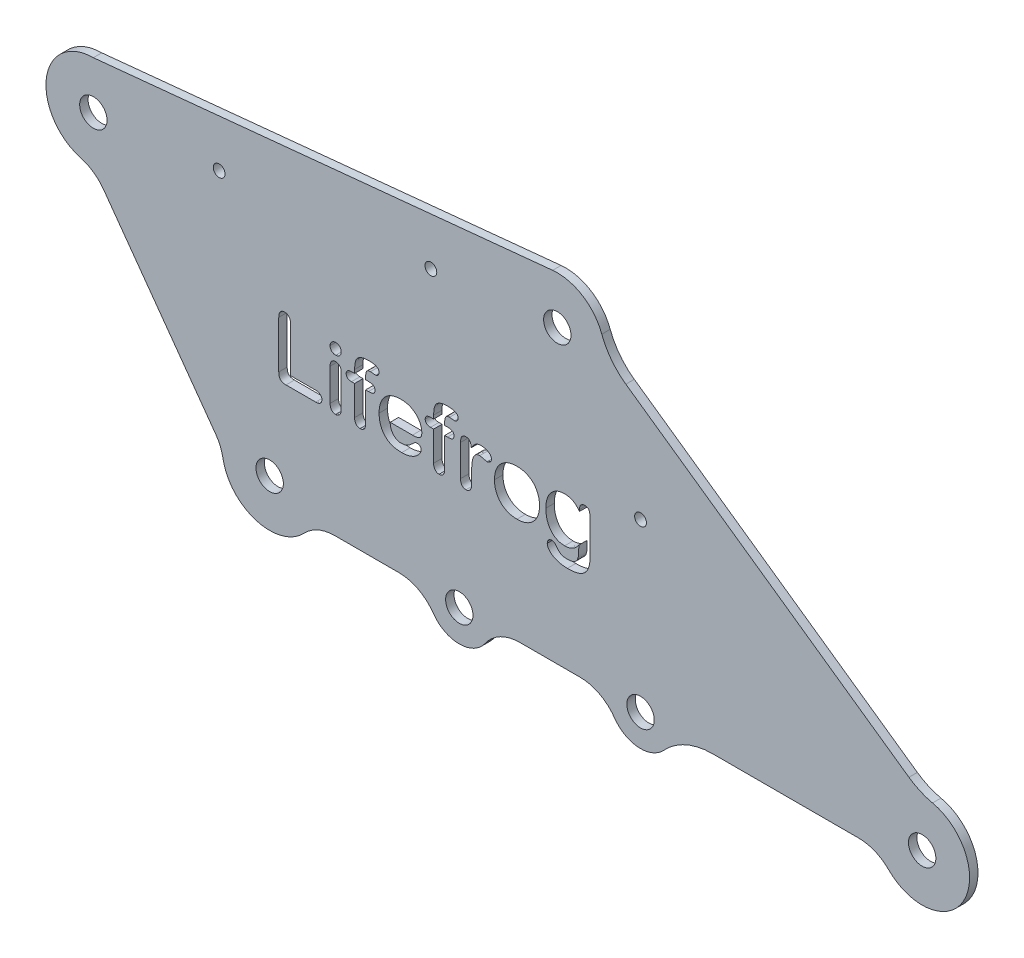
from build123d import *

# Parameters (mm, degrees)
SKETCH2_R           = 3.25
BOSS_EXTRUDE1_DEPTH = 2
SKETCH7_R           = 1.4
CUT_EXTRUDE4_DEPTH  = 170.227847288
CUT_EXTRUDE5_DEPTH  = 10
SKETCH8_R           = 4.443707928
SKETCH8_R_2         = 3.98713944
CUT_EXTRUDE6_DEPTH  = 10


with BuildPart() as part:
    # Sketch2 → Boss-Extrude1 (new body)
    with BuildSketch(Plane.XY):
        with BuildLine():
            Line((-146.482261324, -3.415116213), (-119.900209046, -40.345357838))
            ThreePointArc((-119.900209046, -40.345357838), (-118.800607084, -42.305283789), (-118.166440512, -44.46126778))
            ThreePointArc((-118.166440512, -44.46126778), (-110.313224995, -53.296457195), (-98.896144571, -50.233151699))
            ThreePointArc((-98.896144571, -50.233151699), (-95.581387, -47.909162096), (-91.616909182, -47.089734824))
            Line((-91.616909182, -47.089734824), (-76.446691, -47.089734824))
            ThreePointArc((-76.446691, -47.089734824), (-71.817590501, -48.22568222), (-68.240172934, -51.37544911))
            ThreePointArc((-68.240172934, -51.37544911), (-62.085284384, -54.589734824), (-55.930395834, -51.37544911))
            ThreePointArc((-55.930395834, -51.37544911), (-52.352978266, -48.22568222), (-47.723877768, -47.089734824))
            Line((-47.723877768, -47.089734824), (-33.446691, -47.089734824))
            ThreePointArc((-33.446691, -47.089734824), (-28.817590501, -48.22568222), (-25.240172934, -51.37544911))
            ThreePointArc((-25.240172934, -51.37544911), (-19.593639667, -54.572486651), (-13.566591065, -52.168516573))
            ThreePointArc((-13.566591065, -52.168516573), (-8.311100334, -48.415273127), (-1.990501675, -47.089734824))
            Line((-1.990501675, -47.089734824), (32.686636747, -47.089734824))
            ThreePointArc((32.686636747, -47.089734824), (36.521461692, -47.854253372), (39.769927676, -50.030911295))
            ThreePointArc((39.769927676, -50.030911295), (57.590414229, -47.521571248), (50.200722675, -31.112458317))
            ThreePointArc((50.200722675, -31.112458317), (47.278407153, -30.14859154), (44.599620096, -28.63430389))
            Line((44.599620096, -28.63430389), (-22.564700668, 18.554547573))
            ThreePointArc((-22.564700668, 18.554547573), (-25.986792869, 21.830620173), (-28.278442139, 25.976908916))
            ThreePointArc((-28.278442139, 25.976908916), (-32.864492812, 31.616465892), (-39.941717654, 33.27458296))
            Line((-39.941717654, 33.27458296), (-148.918739614, 22.469864413))
            ThreePointArc((-148.918739614, 22.469864413), (-160.065949313, 12.737169894), (-151.925623591, 0.379147243))
            ThreePointArc((-151.925623591, 0.379147243), (-148.880072017, -1.053350399), (-146.482261324, -3.415116213))
        make_face()
        with Locations((47.738629971, -42.089734824)):
            Circle(SKETCH2_R, mode=Mode.SUBTRACT)
        with Locations((-19.085284384, -47.089734824)):
            Circle(SKETCH2_R, mode=Mode.SUBTRACT)
        with Locations((-62.085284384, -47.089734824)):
            Circle(SKETCH2_R, mode=Mode.SUBTRACT)
        with Locations((-107.085284384, -42.519495684)):
            Circle(SKETCH2_R, mode=Mode.SUBTRACT)
        with Locations((-148.918739614, 11.219864413)):
            Circle(SKETCH2_R, mode=Mode.SUBTRACT)
        with Locations((-38.831758764, 22.07947281)):
            Circle(SKETCH2_R, mode=Mode.SUBTRACT)
    extrude(amount=BOSS_EXTRUDE1_DEPTH)

    # Sketch7 → Cut-Extrude4 (cut, through all)
    with BuildSketch(Plane.XY.offset(2)):
        with Locations((-119.063647537, 14.164941171)):
            Circle(SKETCH7_R)
        with Locations((-68.831758764, 19.120101507)):
            Circle(SKETCH7_R)
        with Locations((-19.085284384, -7.519495684)):
            Circle(SKETCH7_R)
    extrude(amount=-CUT_EXTRUDE4_DEPTH, mode=Mode.SUBTRACT)

    # Sketch5 → Cut-Extrude5 (cut)
    # profile 1 of 9: a face of its own
    with BuildSketch(Plane.XY.offset(2)):
        with BuildLine():
            Line((-102.115894244, -8.88917677), (-102.115894244, -19.477067395))
            Line((-102.115894244, -19.477067395), (-96.162769244, -19.477067395))
            add(Edge.make_bspline(
                [(-96.162769244, -19.477067395), (-96.051007313, -19.479993195), (-95.837884188, -19.485572515), (-95.539916783, -19.554542719), (-95.278875028, -19.661257744), (-95.067813968, -19.819951832), (-94.897692681, -20.005566477), (-94.774137444, -20.217869304), (-94.701867925, -20.454899643), (-94.69344353, -20.620129964), (-94.689136431, -20.704606457)],
                knots=[0, 0, 0, 0, 1.240270116, 2.365118784, 3.381765818, 4.352609133, 5.275186246, 6.165500839, 7.062084633, 8, 8, 8, 8], degree=3))
            add(Edge.make_bspline(
                [(-94.689136431, -20.704606457), (-94.693268201, -20.791061883), (-94.701260642, -20.958300126), (-94.774223839, -21.197153566), (-94.896313466, -21.407864411), (-95.064278317, -21.589554136), (-95.275076024, -21.739731647), (-95.534926018, -21.839448431), (-95.834238111, -21.905877279), (-96.049070498, -21.911559901), (-96.162769244, -21.914567395)],
                knots=[0, 0, 0, 0, 0.961785517, 1.860465312, 2.752861249, 3.654173772, 4.599371787, 5.609990076, 6.735101654, 8, 8, 8, 8], degree=3))
            Line((-96.162769244, -21.914567395), (-103.205737994, -21.914567395))
            add(Edge.make_bspline(
                [(-103.205737994, -21.914567395), (-103.348861132, -21.910822677), (-103.615411062, -21.903848583), (-103.983050705, -21.820051925), (-104.292130258, -21.691568649), (-104.538399287, -21.496286799), (-104.719909675, -21.2361672), (-104.844114456, -20.915092293), (-104.914328704, -20.530846545), (-104.923491067, -20.25471837), (-104.928394244, -20.106950207)],
                knots=[0, 0, 0, 0, 1.184943227, 2.206816713, 3.109923682, 3.939837529, 4.776053014, 5.71019795, 6.774627611, 8, 8, 8, 8], degree=3))
            Line((-104.928394244, -20.106950207), (-104.928394244, -8.88917677))
            add(Edge.make_bspline(
                [(-104.928394244, -8.88917677), (-104.924770448, -8.749162056), (-104.917946116, -8.485486372), (-104.845257533, -8.118037422), (-104.725580552, -7.804802622), (-104.557073154, -7.546892469), (-104.345359797, -7.348035389), (-104.103133358, -7.202614303), (-103.828238086, -7.118889739), (-103.635988236, -7.107793002), (-103.536792681, -7.102067395)],
                knots=[0, 0, 0, 0, 1.312227502, 2.471186598, 3.495416453, 4.440711492, 5.33513045, 6.197779038, 7.0701043, 8, 8, 8, 8], degree=3))
            add(Edge.make_bspline(
                [(-103.536792681, -7.102067395), (-103.435486672, -7.106162598), (-103.238729888, -7.114116312), (-102.960533725, -7.204196573), (-102.711018875, -7.34317393), (-102.496727467, -7.541754535), (-102.319699564, -7.795771782), (-102.199312355, -8.111096688), (-102.125957592, -8.481501141), (-102.119399349, -8.747181708), (-102.115894244, -8.88917677)],
                knots=[0, 0, 0, 0, 0.937651975, 1.821110013, 2.686129292, 3.571911612, 4.510265029, 5.535848738, 6.683015045, 8, 8, 8, 8], degree=3))
        make_face()
    # profile 2 of 9: a face of its own
    with BuildSketch(Plane.XY.offset(2)):
        with BuildLine():
            Line((-90.115894244, -12.74464552), (-90.115894244, -20.476090832))
            add(Edge.make_bspline(
                [(-90.115894244, -20.476090832), (-90.119794378, -20.602435528), (-90.127150905, -20.84074997), (-90.197032734, -21.174236118), (-90.314116621, -21.460321774), (-90.479508659, -21.694972614), (-90.682688675, -21.876468441), (-90.91257444, -22.009165841), (-91.170561441, -22.087195916), (-91.35072121, -22.097028675), (-91.443042681, -22.102067395)],
                knots=[0, 0, 0, 0, 1.279660949, 2.41372764, 3.434282009, 4.393028164, 5.297478756, 6.175532382, 7.06506577, 8, 8, 8, 8], degree=3))
            add(Edge.make_bspline(
                [(-91.443042681, -22.102067395), (-91.535510198, -22.097531408), (-91.714376796, -22.08875712), (-91.96856286, -22.004912745), (-92.195763486, -21.871389965), (-92.391201556, -21.682373157), (-92.551255931, -21.445866625), (-92.661127298, -21.160395096), (-92.729043835, -20.832780478), (-92.736793903, -20.599508451), (-92.740894244, -20.476090832)],
                knots=[0, 0, 0, 0, 0.944656094, 1.82731652, 2.710883517, 3.62364324, 4.589202842, 5.612771424, 6.736985008, 8, 8, 8, 8], degree=3))
            Line((-92.740894244, -20.476090832), (-92.740894244, -12.823747082))
            add(Edge.make_bspline(
                [(-92.740894244, -12.823747082), (-92.736699871, -12.699382119), (-92.728769083, -12.464230884), (-92.662517274, -12.136087305), (-92.551799881, -11.854229206), (-92.391012747, -11.625466775), (-92.194397213, -11.44586487), (-91.968144037, -11.317596829), (-91.713355602, -11.241954113), (-91.535359197, -11.232151465), (-91.443042681, -11.227067395)],
                knots=[0, 0, 0, 0, 1.282601348, 2.425162879, 3.437763456, 4.38569495, 5.284727511, 6.164859808, 7.048218153, 8, 8, 8, 8], degree=3))
            add(Edge.make_bspline(
                [(-91.443042681, -11.227067395), (-91.350780374, -11.232364163), (-91.171013808, -11.242684541), (-90.912920439, -11.316791228), (-90.682617286, -11.446472242), (-90.482415238, -11.624386887), (-90.315350707, -11.846010703), (-90.198859156, -12.112795725), (-90.127488314, -12.416719887), (-90.119879855, -12.631916842), (-90.115894244, -12.74464552)],
                knots=[0, 0, 0, 0, 0.975882645, 1.901438153, 2.812865763, 3.75006033, 4.717368935, 5.725761173, 6.808663735, 8, 8, 8, 8], degree=3))
        make_face()
    # profile 3 of 9: a face of its own
    with BuildSketch(Plane.XY.offset(2)):
        with BuildLine():
            add(Edge.make_bspline(
                [(-91.413745806, -9.914567395), (-91.502059692, -9.911112501), (-91.674377381, -9.904371326), (-91.923091601, -9.837014704), (-92.15078929, -9.726888524), (-92.357720239, -9.578448802), (-92.529720608, -9.386651845), (-92.655762931, -9.154497095), (-92.729492495, -8.885778489), (-92.73699213, -8.695310105), (-92.740894244, -8.59620802)],
                knots=[0, 0, 0, 0, 1.006201835, 1.963296869, 2.915511555, 3.880878732, 4.85189213, 5.829536295, 6.870691953, 8, 8, 8, 8], degree=3))
            add(Edge.make_bspline(
                [(-92.740894244, -8.59620802), (-92.735711958, -8.504891338), (-92.725668701, -8.327919822), (-92.650545078, -8.073896193), (-92.521388078, -7.848246813), (-92.347766447, -7.652100465), (-92.141388488, -7.494003153), (-91.916161531, -7.371969471), (-91.66963809, -7.303278473), (-91.500084931, -7.29419357), (-91.413745806, -7.289567395)],
                knots=[0, 0, 0, 0, 1.057408726, 2.04925565, 3.037480321, 4.047814229, 5.064214746, 6.036169889, 6.999986943, 8, 8, 8, 8], degree=3))
            add(Edge.make_bspline(
                [(-91.413745806, -7.289567395), (-91.330331688, -7.293289281), (-91.166969837, -7.300578386), (-90.929246738, -7.365176401), (-90.707981257, -7.471719022), (-90.506122496, -7.61868617), (-90.327667655, -7.801949122), (-90.205863506, -8.035133325), (-90.125225569, -8.302838261), (-90.119114728, -8.494958443), (-90.115894244, -8.59620802)],
                knots=[0, 0, 0, 0, 0.967133894, 1.894077239, 2.837452275, 3.803721558, 4.782485793, 5.777084342, 6.828497526, 8, 8, 8, 8], degree=3))
            add(Edge.make_bspline(
                [(-90.115894244, -8.59620802), (-90.119666741, -8.694407685), (-90.126915601, -8.883098506), (-90.202445242, -9.148438196), (-90.323346226, -9.381879948), (-90.497008149, -9.571319036), (-90.697722159, -9.722899361), (-90.920078487, -9.833786351), (-91.160369106, -9.904963009), (-91.328281937, -9.911327839), (-91.413745806, -9.914567395)],
                knots=[0, 0, 0, 0, 1.133982342, 2.178948973, 3.165031597, 4.149752721, 5.126395816, 6.06160272, 7.013399203, 8, 8, 8, 8], degree=3))
        make_face()
    # profile 4 of 9: a face of its own
    with BuildSketch(Plane.XY.offset(2)):
        with BuildLine():
            Line((-87.569995806, -11.414567395), (-86.928394244, -11.414567395))
            Line((-86.928394244, -11.414567395), (-86.928394244, -10.591325207))
            add(Edge.make_bspline(
                [(-86.928394244, -10.591325207), (-86.924700914, -10.388045332), (-86.917705381, -10.00301306), (-86.859665412, -9.457909943), (-86.765573069, -8.978381027), (-86.632882133, -8.557808501), (-86.446581198, -8.195572563), (-86.205604775, -7.887535194), (-85.908437152, -7.633608774), (-85.553484837, -7.431434885), (-85.135146039, -7.280410479), (-84.649682076, -7.174729198), (-84.094123419, -7.111487828), (-83.700058626, -7.105323868), (-83.491870806, -7.102067395)],
                knots=[0, 0, 0, 0, 1.272338929, 2.409936283, 3.426662608, 4.327577154, 5.161578725, 5.96266415, 6.760383261, 7.592994418, 8.506024445, 9.533847079, 10.697110196, 12, 12, 12, 12], degree=3))
            add(Edge.make_bspline(
                [(-83.491870806, -7.102067395), (-83.307068191, -7.104261268), (-82.960801066, -7.108371958), (-82.478567661, -7.168286024), (-82.066452312, -7.255167266), (-81.72918291, -7.391161667), (-81.457325514, -7.558653085), (-81.264450259, -7.776533401), (-81.14794255, -8.037027657), (-81.134555018, -8.223910447), (-81.127612994, -8.320817395)],
                knots=[0, 0, 0, 0, 1.495564663, 2.802259462, 3.930374803, 4.895312065, 5.735498063, 6.492167842, 7.218122695, 8, 8, 8, 8], degree=3))
            add(Edge.make_bspline(
                [(-81.127612994, -8.320817395), (-81.13016044, -8.384563693), (-81.135172155, -8.509974928), (-81.182649106, -8.690669099), (-81.264942883, -8.855101057), (-81.371125512, -9.002344218), (-81.498609867, -9.125761707), (-81.641283549, -9.215318606), (-81.796289851, -9.272564588), (-81.904462105, -9.278650351), (-81.959644244, -9.281754895)],
                knots=[0, 0, 0, 0, 1.08569999, 2.135951137, 3.156332465, 4.20565892, 5.218674748, 6.161348951, 7.062045096, 8, 8, 8, 8], degree=3))
            add(Edge.make_bspline(
                [(-81.959644244, -9.281754895), (-81.990923875, -9.281243662), (-82.062451162, -9.280074624), (-82.184322966, -9.265550853), (-82.335069813, -9.249871502), (-82.562596635, -9.213428957), (-82.838380297, -9.175272517), (-83.05620293, -9.167906783), (-83.154956744, -9.164567395)],
                knots=[0, 0, 0, 0, 0.468218035, 1.070676523, 1.83620524, 2.737967929, 4.521099009, 6, 6, 6, 6], degree=3))
            add(Edge.make_bspline(
                [(-83.154956744, -9.164567395), (-83.266879767, -9.168513751), (-83.471705369, -9.175735811), (-83.748826522, -9.253609551), (-83.965776352, -9.387787922), (-84.108374405, -9.587280743), (-84.19515756, -9.82836939), (-84.25744231, -10.108223991), (-84.299579902, -10.432859402), (-84.302069643, -10.66441903), (-84.303394244, -10.78761427)],
                knots=[0, 0, 0, 0, 1.158634456, 2.120368021, 2.955008234, 3.751380872, 4.611223429, 5.599229928, 6.722733105, 8, 8, 8, 8], degree=3))
            Line((-84.303394244, -10.78761427), (-84.303394244, -11.414567395))
            Line((-84.303394244, -11.414567395), (-83.638355181, -11.414567395))
            add(Edge.make_bspline(
                [(-83.638355181, -11.414567395), (-83.518035883, -11.416649074), (-83.291972191, -11.420560268), (-82.976422378, -11.467875581), (-82.70599729, -11.540251074), (-82.484005335, -11.648680399), (-82.308648107, -11.789413733), (-82.185554218, -11.965226471), (-82.107884225, -12.172143548), (-82.10096014, -12.32106946), (-82.097339556, -12.398942395)],
                knots=[0, 0, 0, 0, 1.396050608, 2.622990337, 3.6962846, 4.634546857, 5.472373731, 6.277878481, 7.09950757, 8, 8, 8, 8], degree=3))
            add(Edge.make_bspline(
                [(-82.097339556, -12.398942395), (-82.101430239, -12.506003658), (-82.10888127, -12.701011923), (-82.184683124, -12.965095468), (-82.314039334, -13.171513058), (-82.509943835, -13.302589493), (-82.740907301, -13.37783369), (-83.005840503, -13.437731598), (-83.309405986, -13.470942071), (-83.525001195, -13.474956644), (-83.638355181, -13.477067395)],
                knots=[0, 0, 0, 0, 1.171181197, 2.133264703, 2.982673099, 3.781862637, 4.659228062, 5.636037739, 6.757094158, 8, 8, 8, 8], degree=3))
            Line((-83.638355181, -13.477067395), (-84.303394244, -13.477067395))
            Line((-84.303394244, -13.477067395), (-84.303394244, -20.49073927))
            add(Edge.make_bspline(
                [(-84.303394244, -20.49073927), (-84.307324323, -20.614179922), (-84.314789501, -20.848655192), (-84.385280454, -21.176561155), (-84.498848793, -21.461585314), (-84.664152095, -21.695052259), (-84.866845108, -21.875428653), (-85.095501488, -22.010618694), (-85.355317063, -22.086940159), (-85.537294849, -22.096942211), (-85.630542681, -22.102067395)],
                knots=[0, 0, 0, 0, 1.256538349, 2.386792053, 3.399650087, 4.363398215, 5.272567509, 6.146574889, 7.050280375, 8, 8, 8, 8], degree=3))
            add(Edge.make_bspline(
                [(-85.630542681, -22.102067395), (-85.719989993, -22.09710813), (-85.894515188, -22.087431855), (-86.145054229, -22.007724342), (-86.370556982, -21.876461922), (-86.570766574, -21.694722042), (-86.732567229, -21.460721404), (-86.846686793, -21.176665365), (-86.916946166, -20.8486244), (-86.924445947, -20.614169302), (-86.928394244, -20.49073927)],
                knots=[0, 0, 0, 0, 0.920542794, 1.796117823, 2.680158831, 3.592296685, 4.561321835, 5.585807508, 6.729036556, 8, 8, 8, 8], degree=3))
            Line((-86.928394244, -20.49073927), (-86.928394244, -13.477067395))
            Line((-86.928394244, -13.477067395), (-87.669605181, -13.477067395))
            add(Edge.make_bspline(
                [(-87.669605181, -13.477067395), (-87.764717637, -13.474545828), (-87.945069974, -13.469764431), (-88.197602841, -13.411306638), (-88.420159882, -13.326305771), (-88.603573939, -13.197615767), (-88.750908304, -13.041843238), (-88.850169927, -12.858126156), (-88.916372739, -12.656347119), (-88.923007314, -12.513757181), (-88.926441119, -12.43995802)],
                knots=[0, 0, 0, 0, 1.239726906, 2.350771435, 3.369360947, 4.331849643, 5.252604265, 6.143447782, 7.039118766, 8, 8, 8, 8], degree=3))
            add(Edge.make_bspline(
                [(-88.926441119, -12.43995802), (-88.923283957, -12.359364997), (-88.9172753, -12.205981751), (-88.850749549, -11.99217143), (-88.742401324, -11.809230275), (-88.589026748, -11.659732473), (-88.391857426, -11.547566221), (-88.154756492, -11.470404208), (-87.876811847, -11.419710271), (-87.676697567, -11.416355939), (-87.569995806, -11.414567395)],
                knots=[0, 0, 0, 0, 0.995382564, 1.894394861, 2.740686784, 3.604514537, 4.515167111, 5.524921804, 6.68027808, 8, 8, 8, 8], degree=3))
        make_face()
    # profile 5 of 9: a face of its own
    with BuildSketch(Plane.XY.offset(2)):
        with BuildLine():
            Line((-73.208667681, -17.227067395), (-78.490894244, -17.227067395))
            add(Edge.make_bspline(
                [(-78.490894244, -17.227067395), (-78.485729032, -17.373895282), (-78.475607796, -17.661604604), (-78.399500086, -18.07799563), (-78.286354508, -18.469071713), (-78.128567635, -18.829619398), (-77.931660235, -19.153364248), (-77.709449566, -19.442705533), (-77.451707834, -19.684973297), (-77.165756761, -19.88267243), (-76.856444567, -20.033615445), (-76.531732066, -20.148105778), (-76.18967889, -20.212156224), (-75.956959932, -20.222066531), (-75.839527056, -20.227067395)],
                knots=[0, 0, 0, 0, 1.179639705, 2.311504614, 3.392005435, 4.44652888, 5.46432702, 6.431680492, 7.370191764, 8.295643874, 9.215452015, 10.129041871, 11.055891293, 12, 12, 12, 12], degree=3))
            add(Edge.make_bspline(
                [(-75.839527056, -20.227067395), (-75.684899945, -20.221290078), (-75.38699415, -20.210159454), (-74.953894078, -20.128402077), (-74.55183901, -19.976572402), (-74.172233727, -19.770423211), (-73.819626408, -19.521193305), (-73.535198858, -19.296133613), (-73.30788746, -19.094787244), (-73.116419912, -18.918875484), (-72.897546603, -18.722900775), (-72.746482696, -18.581855292), (-72.666675494, -18.507340832)],
                knots=[0, 0, 0, 0, 1.247905556, 2.404224554, 3.538983975, 4.702801183, 5.881313568, 7.020008393, 7.628790321, 8.331868978, 9.11872483, 10, 10, 10, 10], degree=3))
            add(Edge.make_bspline(
                [(-72.666675494, -18.507340832), (-72.629561272, -18.48027204), (-72.552305707, -18.423926662), (-72.410745358, -18.369543996), (-72.248164227, -18.338198915), (-72.132654468, -18.333846809), (-72.071948931, -18.331559582)],
                knots=[0, 0, 0, 0, 0.868866131, 1.808598965, 2.848320883, 4, 4, 4, 4], degree=3))
            add(Edge.make_bspline(
                [(-72.071948931, -18.331559582), (-72.005205088, -18.333900139), (-71.877920585, -18.33836372), (-71.698147996, -18.385198991), (-71.535535781, -18.453914722), (-71.397435702, -18.559309462), (-71.281141949, -18.686697731), (-71.200775579, -18.843467551), (-71.148932879, -19.021621344), (-71.145191899, -19.149522649), (-71.143237994, -19.216325207)],
                knots=[0, 0, 0, 0, 1.102465736, 2.102468148, 3.057950005, 4.00546365, 4.956145095, 5.889200524, 6.897534264, 8, 8, 8, 8], degree=3))
            add(Edge.make_bspline(
                [(-71.143237994, -19.216325207), (-71.147074427, -19.281058441), (-71.155207149, -19.418284177), (-71.211530831, -19.630580971), (-71.30468497, -19.856403047), (-71.430534653, -20.095129398), (-71.589870145, -20.341196211), (-71.792561168, -20.580823639), (-72.027283373, -20.819411181), (-72.299993333, -21.049528185), (-72.606870884, -21.269822809), (-72.952879871, -21.470546591), (-73.33797498, -21.646257285), (-73.755957021, -21.809324299), (-74.209350401, -21.941257019), (-74.697887614, -22.0333954), (-75.217872478, -22.094193404), (-75.576651345, -22.099400308), (-75.760425494, -22.102067395)],
                knots=[0, 0, 0, 0, 0.525537938, 1.114069654, 1.772306998, 2.506549159, 3.302753817, 4.147512317, 5.050313588, 6.017967943, 7.041213872, 8.114344659, 9.260276936, 10.47524946, 11.755151616, 13.087980653, 14.508401902, 16, 16, 16, 16], degree=3))
            add(Edge.make_bspline(
                [(-75.760425494, -22.102067395), (-75.970566234, -22.097519737), (-76.380250285, -22.088653761), (-76.975430681, -22.021353682), (-77.533004004, -21.908362258), (-78.051645226, -21.745772772), (-78.534701665, -21.542562166), (-78.978161462, -21.288395048), (-79.381535863, -20.987522623), (-79.746754804, -20.64373407), (-80.067772398, -20.257975864), (-80.351874822, -19.841633038), (-80.585884137, -19.388813691), (-80.780372736, -18.905299727), (-80.932098867, -18.389217889), (-81.040075091, -17.840151988), (-81.10545073, -17.258936562), (-81.112357264, -16.86005426), (-81.115894244, -16.655778332)],
                knots=[0, 0, 0, 0, 1.161895415, 2.265196273, 3.307380836, 4.303185105, 5.266158709, 6.199917451, 7.122316156, 8.043005893, 8.966794753, 9.89246016, 10.824859252, 11.779559524, 12.770652002, 13.794812853, 14.87067777, 16, 16, 16, 16], degree=3))
            add(Edge.make_bspline(
                [(-81.115894244, -16.655778332), (-81.112351374, -16.462226663), (-81.105370439, -16.080848933), (-81.038259091, -15.519624607), (-80.933763598, -14.979723953), (-80.788486547, -14.462108781), (-80.598046656, -13.975533109), (-80.372921593, -13.519340339), (-80.104117762, -13.102077052), (-79.799927638, -12.718106315), (-79.451233704, -12.376213514), (-79.061234287, -12.074737303), (-78.628998548, -11.817183613), (-78.157129599, -11.603132446), (-77.650787767, -11.433045112), (-77.112381625, -11.315293392), (-76.545831122, -11.238702527), (-76.158145954, -11.231007425), (-75.959644244, -11.227067395)],
                knots=[0, 0, 0, 0, 1.095507523, 2.15860795, 3.195309999, 4.206995944, 5.197887526, 6.149926361, 7.082497361, 8.003040645, 8.917987058, 9.840388418, 10.787726911, 11.760164811, 12.769081724, 13.806049167, 14.876658106, 16, 16, 16, 16], degree=3))
            add(Edge.make_bspline(
                [(-75.959644244, -11.227067395), (-75.82967599, -11.22810589), (-75.575169739, -11.23013949), (-75.200806959, -11.265268194), (-74.839711595, -11.313850777), (-74.491487894, -11.382379075), (-74.15967654, -11.478141357), (-73.841160582, -11.589179566), (-73.536096258, -11.720379466), (-73.247093024, -11.874248291), (-72.971225393, -12.038773815), (-72.717190296, -12.223475089), (-72.475441109, -12.411434191), (-72.254440606, -12.616494045), (-72.04918298, -12.831425773), (-71.86543806, -13.06140635), (-71.695754099, -13.299708893), (-71.501065769, -13.632045496), (-71.29721699, -14.058699678), (-71.115470707, -14.582630241), (-71.005629179, -15.115069491), (-70.991884998, -15.472667779), (-70.985034869, -15.65089552)],
                knots=[0, 0, 0, 0, 1.048847282, 2.053872234, 3.03283051, 3.989924751, 4.915857681, 5.818505585, 6.711913066, 7.593554535, 8.460263899, 9.302531452, 10.127499996, 10.930978608, 11.734070318, 12.524563272, 13.305443929, 14.093732096, 15.631266151, 17.114748765, 18.561984696, 20, 20, 20, 20], degree=3))
            add(Edge.make_bspline(
                [(-70.985034869, -15.65089552), (-70.986604018, -15.730068621), (-70.989597069, -15.881086234), (-71.015277956, -16.097314554), (-71.061442947, -16.291180146), (-71.127161718, -16.464024902), (-71.206726919, -16.617172785), (-71.3094301, -16.74579461), (-71.428239515, -16.854326494), (-71.620032975, -16.968584464), (-71.901445225, -17.07492862), (-72.285671015, -17.164445981), (-72.727625927, -17.219117531), (-73.042486482, -17.224321026), (-73.208667681, -17.227067395)],
                knots=[0, 0, 0, 0, 0.899856074, 1.716417764, 2.470354694, 3.159019517, 3.814679391, 4.423252287, 5.02068589, 5.633798556, 6.949059873, 8.421953477, 10.111532063, 12, 12, 12, 12], degree=3))
        make_face()
        with BuildLine():
            Line((-78.490894244, -15.727067395), (-73.595386431, -15.727067395))
            add(Edge.make_bspline(
                [(-73.595386431, -15.727067395), (-73.604322953, -15.620388862), (-73.621708392, -15.412852503), (-73.676971373, -15.113999216), (-73.741925544, -14.835108466), (-73.828072086, -14.577543089), (-73.929671959, -14.341165405), (-74.047709808, -14.123236857), (-74.184828665, -13.928050969), (-74.338373242, -13.753386376), (-74.507240019, -13.600302554), (-74.687703579, -13.465060191), (-74.88367525, -13.352382039), (-75.092871169, -13.262997606), (-75.31249975, -13.187447347), (-75.546992381, -13.140138129), (-75.792574806, -13.105158478), (-75.961461832, -13.103110926), (-76.047534869, -13.102067395)],
                knots=[0, 0, 0, 0, 1.274652096, 2.479755284, 3.617009281, 4.684005428, 5.71065458, 6.679155714, 7.63137599, 8.546404667, 9.444107911, 10.342338794, 11.228430864, 12.129821099, 13.049645363, 13.989847955, 14.975528821, 16, 16, 16, 16], degree=3))
            add(Edge.make_bspline(
                [(-76.047534869, -13.102067395), (-76.129637456, -13.10475237), (-76.290452304, -13.110011447), (-76.527254178, -13.138599654), (-76.752039842, -13.191199261), (-76.965729073, -13.265652746), (-77.168337697, -13.359118289), (-77.35978224, -13.474146939), (-77.539458013, -13.609700616), (-77.706839063, -13.766189336), (-77.862846038, -13.941320054), (-78.000334453, -14.138573533), (-78.120382782, -14.355594311), (-78.229866787, -14.589561112), (-78.320263624, -14.845787112), (-78.392374485, -15.122470817), (-78.451283959, -15.417941176), (-78.477480377, -15.622383021), (-78.490894244, -15.727067395)],
                knots=[0, 0, 0, 0, 0.988988761, 1.937138454, 2.867098831, 3.763434994, 4.657917626, 5.549380048, 6.447873833, 7.363218941, 8.304708192, 9.267190604, 10.251834605, 11.288414524, 12.374576878, 13.518478699, 14.729337904, 16, 16, 16, 16], degree=3))
        make_face(mode=Mode.SUBTRACT)
    # profile 6 of 9: a face of its own
    with BuildSketch(Plane.XY.offset(2)):
        with BuildLine():
            Line((-68.819995806, -11.414567395), (-68.178394244, -11.414567395))
            Line((-68.178394244, -11.414567395), (-68.178394244, -10.591325207))
            add(Edge.make_bspline(
                [(-68.178394244, -10.591325207), (-68.174700914, -10.388045332), (-68.167705381, -10.00301306), (-68.109665412, -9.457909943), (-68.015573069, -8.978381027), (-67.882882133, -8.557808501), (-67.696581198, -8.195572563), (-67.455604775, -7.887535194), (-67.158437152, -7.633608774), (-66.803484837, -7.431434885), (-66.385146039, -7.280410479), (-65.899682076, -7.174729198), (-65.344123419, -7.111487828), (-64.950058626, -7.105323868), (-64.741870806, -7.102067395)],
                knots=[0, 0, 0, 0, 1.272338929, 2.409936283, 3.426662608, 4.327577154, 5.161578725, 5.96266415, 6.760383261, 7.592994418, 8.506024445, 9.533847079, 10.697110196, 12, 12, 12, 12], degree=3))
            add(Edge.make_bspline(
                [(-64.741870806, -7.102067395), (-64.557068191, -7.104261268), (-64.210801066, -7.108371958), (-63.728567661, -7.168286024), (-63.316452312, -7.255167266), (-62.97918291, -7.391161667), (-62.707325514, -7.558653085), (-62.514450259, -7.776533401), (-62.39794255, -8.037027657), (-62.384555018, -8.223910447), (-62.377612994, -8.320817395)],
                knots=[0, 0, 0, 0, 1.495564663, 2.802259462, 3.930374803, 4.895312065, 5.735498063, 6.492167842, 7.218122695, 8, 8, 8, 8], degree=3))
            add(Edge.make_bspline(
                [(-62.377612994, -8.320817395), (-62.38016044, -8.384563693), (-62.385172155, -8.509974928), (-62.432649106, -8.690669099), (-62.514942883, -8.855101057), (-62.621125512, -9.002344218), (-62.748609867, -9.125761707), (-62.891283549, -9.215318606), (-63.046289851, -9.272564588), (-63.154462105, -9.278650351), (-63.209644244, -9.281754895)],
                knots=[0, 0, 0, 0, 1.08569999, 2.135951137, 3.156332465, 4.20565892, 5.218674748, 6.161348951, 7.062045096, 8, 8, 8, 8], degree=3))
            add(Edge.make_bspline(
                [(-63.209644244, -9.281754895), (-63.240923875, -9.281243662), (-63.312451162, -9.280074624), (-63.434322966, -9.265550853), (-63.585069813, -9.249871502), (-63.812596635, -9.213428957), (-64.088380297, -9.175272517), (-64.30620293, -9.167906783), (-64.404956744, -9.164567395)],
                knots=[0, 0, 0, 0, 0.468218035, 1.070676523, 1.83620524, 2.737967929, 4.521099009, 6, 6, 6, 6], degree=3))
            add(Edge.make_bspline(
                [(-64.404956744, -9.164567395), (-64.516879767, -9.168513751), (-64.721705369, -9.175735811), (-64.998826522, -9.253609551), (-65.215776352, -9.387787922), (-65.358374405, -9.587280743), (-65.44515756, -9.82836939), (-65.50744231, -10.108223991), (-65.549579902, -10.432859402), (-65.552069643, -10.66441903), (-65.553394244, -10.78761427)],
                knots=[0, 0, 0, 0, 1.158634456, 2.120368021, 2.955008234, 3.751380872, 4.611223429, 5.599229928, 6.722733105, 8, 8, 8, 8], degree=3))
            Line((-65.553394244, -10.78761427), (-65.553394244, -11.414567395))
            Line((-65.553394244, -11.414567395), (-64.888355181, -11.414567395))
            add(Edge.make_bspline(
                [(-64.888355181, -11.414567395), (-64.768035883, -11.416649074), (-64.541972191, -11.420560268), (-64.226422378, -11.467875581), (-63.95599729, -11.540251074), (-63.734005335, -11.648680399), (-63.558648107, -11.789413733), (-63.435554218, -11.965226471), (-63.357884225, -12.172143548), (-63.35096014, -12.32106946), (-63.347339556, -12.398942395)],
                knots=[0, 0, 0, 0, 1.396050608, 2.622990337, 3.6962846, 4.634546857, 5.472373731, 6.277878481, 7.09950757, 8, 8, 8, 8], degree=3))
            add(Edge.make_bspline(
                [(-63.347339556, -12.398942395), (-63.351430239, -12.506003658), (-63.35888127, -12.701011923), (-63.434683124, -12.965095468), (-63.564039334, -13.171513058), (-63.759943835, -13.302589493), (-63.990907301, -13.37783369), (-64.255840503, -13.437731598), (-64.559405986, -13.470942071), (-64.775001195, -13.474956644), (-64.888355181, -13.477067395)],
                knots=[0, 0, 0, 0, 1.171181197, 2.133264703, 2.982673099, 3.781862637, 4.659228062, 5.636037739, 6.757094158, 8, 8, 8, 8], degree=3))
            Line((-64.888355181, -13.477067395), (-65.553394244, -13.477067395))
            Line((-65.553394244, -13.477067395), (-65.553394244, -20.49073927))
            add(Edge.make_bspline(
                [(-65.553394244, -20.49073927), (-65.557324323, -20.614179922), (-65.564789501, -20.848655192), (-65.635280454, -21.176561155), (-65.748848793, -21.461585314), (-65.914152095, -21.695052259), (-66.116845108, -21.875428653), (-66.345501488, -22.010618694), (-66.605317063, -22.086940159), (-66.787294849, -22.096942211), (-66.880542681, -22.102067395)],
                knots=[0, 0, 0, 0, 1.256538349, 2.386792053, 3.399650087, 4.363398215, 5.272567509, 6.146574889, 7.050280375, 8, 8, 8, 8], degree=3))
            add(Edge.make_bspline(
                [(-66.880542681, -22.102067395), (-66.969989993, -22.09710813), (-67.144515188, -22.087431855), (-67.395054229, -22.007724342), (-67.620556982, -21.876461922), (-67.820766574, -21.694722042), (-67.982567229, -21.460721404), (-68.096686793, -21.176665365), (-68.166946166, -20.8486244), (-68.174445947, -20.614169302), (-68.178394244, -20.49073927)],
                knots=[0, 0, 0, 0, 0.920542794, 1.796117823, 2.680158831, 3.592296685, 4.561321835, 5.585807508, 6.729036556, 8, 8, 8, 8], degree=3))
            Line((-68.178394244, -20.49073927), (-68.178394244, -13.477067395))
            Line((-68.178394244, -13.477067395), (-68.919605181, -13.477067395))
            add(Edge.make_bspline(
                [(-68.919605181, -13.477067395), (-69.014717637, -13.474545828), (-69.195069974, -13.469764431), (-69.447602841, -13.411306638), (-69.670159882, -13.326305771), (-69.853573939, -13.197615767), (-70.000908304, -13.041843238), (-70.100169927, -12.858126156), (-70.166372739, -12.656347119), (-70.173007314, -12.513757181), (-70.176441119, -12.43995802)],
                knots=[0, 0, 0, 0, 1.239726906, 2.350771435, 3.369360947, 4.331849643, 5.252604265, 6.143447782, 7.039118766, 8, 8, 8, 8], degree=3))
            add(Edge.make_bspline(
                [(-70.176441119, -12.43995802), (-70.173283957, -12.359364997), (-70.1672753, -12.205981751), (-70.100749549, -11.99217143), (-69.992401324, -11.809230275), (-69.839026748, -11.659732473), (-69.641857426, -11.547566221), (-69.404756492, -11.470404208), (-69.126811847, -11.419710271), (-68.926697567, -11.416355939), (-68.819995806, -11.414567395)],
                knots=[0, 0, 0, 0, 0.995382564, 1.894394861, 2.740686784, 3.604514537, 4.515167111, 5.524921804, 6.68027808, 8, 8, 8, 8], degree=3))
        make_face()
    # profile 7 of 9: a face of its own
    with BuildSketch(Plane.XY.offset(2)):
        with BuildLine():
            Line((-59.178394244, -18.21730177), (-59.178394244, -20.464372082))
            add(Edge.make_bspline(
                [(-59.178394244, -20.464372082), (-59.182322559, -20.592663462), (-59.189737847, -20.83483283), (-59.259216665, -21.173173015), (-59.375819591, -21.46268977), (-59.542206957, -21.697626109), (-59.744323108, -21.879946249), (-59.975989208, -22.008518529), (-60.232941334, -22.08740627), (-60.413180516, -22.097099946), (-60.505542681, -22.102067395)],
                knots=[0, 0, 0, 0, 1.292414504, 2.439627698, 3.46375878, 4.417332263, 5.316903122, 6.185375834, 7.070109971, 8, 8, 8, 8], degree=3))
            add(Edge.make_bspline(
                [(-60.505542681, -22.102067395), (-60.596898089, -22.09710505), (-60.774228669, -22.087472609), (-61.02762995, -22.009227395), (-61.251604297, -21.875274697), (-61.451984506, -21.695716107), (-61.610499532, -21.458957778), (-61.725504258, -21.174115576), (-61.791218668, -20.840355995), (-61.799173407, -20.602368539), (-61.803394244, -20.476090832)],
                knots=[0, 0, 0, 0, 0.933294383, 1.81162385, 2.680186499, 3.585258456, 4.541104918, 5.566887721, 6.708974649, 8, 8, 8, 8], degree=3))
            Line((-61.803394244, -20.476090832), (-61.803394244, -13.028825207))
            add(Edge.make_bspline(
                [(-61.803394244, -13.028825207), (-61.799730251, -12.887967816), (-61.792849053, -12.623429237), (-61.735776236, -12.253599122), (-61.639567719, -11.937580399), (-61.496254001, -11.678454634), (-61.315514017, -11.470839169), (-61.086826968, -11.325648529), (-60.817640573, -11.24325969), (-60.626241318, -11.232631094), (-60.526050494, -11.227067395)],
                knots=[0, 0, 0, 0, 1.34619872, 2.528241455, 3.567694465, 4.487339067, 5.340335725, 6.171799567, 7.043000931, 8, 8, 8, 8], degree=3))
            add(Edge.make_bspline(
                [(-60.526050494, -11.227067395), (-60.423964078, -11.23166171), (-60.232140874, -11.240294554), (-59.96573528, -11.31618665), (-59.744757761, -11.448839438), (-59.574502888, -11.63900255), (-59.444204249, -11.876050227), (-59.349609385, -12.159893812), (-59.290006047, -12.492418163), (-59.274520952, -12.729745798), (-59.266284869, -12.855973645)],
                knots=[0, 0, 0, 0, 1.044883286, 1.963364657, 2.807970932, 3.650974255, 4.547373518, 5.563477854, 6.704082887, 8, 8, 8, 8], degree=3))
            add(Edge.make_bspline(
                [(-59.266284869, -12.855973645), (-59.187154757, -12.728702257), (-59.035804418, -12.485273209), (-58.787956133, -12.155879517), (-58.540962339, -11.872664951), (-58.284149984, -11.635812705), (-58.002222316, -11.445181426), (-57.676391936, -11.317799074), (-57.309909313, -11.240889927), (-57.051850669, -11.231818927), (-56.916675494, -11.227067395)],
                knots=[0, 0, 0, 0, 1.18924255, 2.274636787, 3.268721947, 4.168850259, 5.041860026, 5.953170485, 6.927838526, 8, 8, 8, 8], degree=3))
            add(Edge.make_bspline(
                [(-56.916675494, -11.227067395), (-56.775747725, -11.232489358), (-56.492853461, -11.243373249), (-56.073052378, -11.320929872), (-55.660920655, -11.453132582), (-55.328766913, -11.600397905), (-55.080670801, -11.742608322), (-54.915701672, -11.857020394), (-54.778751657, -11.98382965), (-54.661785388, -12.115426572), (-54.572123596, -12.257833616), (-54.510761789, -12.409798496), (-54.470136727, -12.569674136), (-54.466414535, -12.679941298), (-54.464527056, -12.735856457)],
                knots=[0, 0, 0, 0, 1.609451603, 3.230765888, 4.857137694, 6.544750347, 7.369389467, 8.121503283, 8.832102741, 9.496362917, 10.127778221, 10.743023735, 11.362602371, 12, 12, 12, 12], degree=3))
            add(Edge.make_bspline(
                [(-54.464527056, -12.735856457), (-54.467767369, -12.813574254), (-54.474044563, -12.9641306), (-54.543416205, -13.177988977), (-54.648650468, -13.372817877), (-54.799251598, -13.536083886), (-54.970071927, -13.670264449), (-55.15351986, -13.768279515), (-55.34434546, -13.830801857), (-55.474819056, -13.839133704), (-55.539722369, -13.843278332)],
                knots=[0, 0, 0, 0, 1.088483127, 2.10862957, 3.128406662, 4.178128692, 5.204900727, 6.16884502, 7.089102868, 8, 8, 8, 8], degree=3))
            add(Edge.make_bspline(
                [(-55.539722369, -13.843278332), (-55.573036344, -13.840040056), (-55.659230674, -13.831661558), (-55.81195832, -13.792022204), (-56.018474751, -13.737267753), (-56.263119245, -13.659990651), (-56.524940328, -13.576472525), (-56.786413638, -13.523477689), (-57.029774565, -13.484406004), (-57.187045252, -13.479444147), (-57.262378619, -13.477067395)],
                knots=[0, 0, 0, 0, 0.454029574, 1.174725489, 2.136679894, 3.357464208, 4.658256254, 5.865202561, 6.977422421, 8, 8, 8, 8], degree=3))
            add(Edge.make_bspline(
                [(-57.262378619, -13.477067395), (-57.356325896, -13.48141761), (-57.53814264, -13.489836608), (-57.799778543, -13.542788927), (-58.031283068, -13.646030446), (-58.238408899, -13.78176069), (-58.417017735, -13.961357491), (-58.574777615, -14.175620461), (-58.709682748, -14.42885195), (-58.822549933, -14.716376161), (-58.914044921, -15.037011302), (-58.992795855, -15.386257938), (-59.057640423, -15.764579045), (-59.102562652, -16.17561647), (-59.138042073, -16.623081436), (-59.159869077, -17.113612554), (-59.17481521, -17.649826852), (-59.177168503, -18.022954037), (-59.178394244, -18.21730177)],
                knots=[0, 0, 0, 0, 0.794050632, 1.536731085, 2.238662641, 2.922771156, 3.616952249, 4.366019506, 5.163320251, 6.033432924, 6.970572952, 7.977209821, 9.05675488, 10.211001348, 11.468820729, 12.84806026, 14.358274693, 16, 16, 16, 16], degree=3))
        make_face()
    # profile 8 of 9: a face of its own
    with BuildSketch(Plane.XY.offset(2)):
        with BuildLine():
            add(Edge.make_bspline(
                [(-43.053394244, -16.67042677), (-43.057728542, -16.865958198), (-43.066252796, -17.250509443), (-43.138520017, -17.815248603), (-43.254958537, -18.356735194), (-43.419004374, -18.872727585), (-43.626659138, -19.359535852), (-43.875574702, -19.813005753), (-44.168674914, -20.230278447), (-44.502042283, -20.609939276), (-44.87324689, -20.9531364), (-45.282555715, -21.251299839), (-45.724083256, -21.51184656), (-46.201220039, -21.724708392), (-46.709713134, -21.896725611), (-47.251272277, -22.014013606), (-47.821725836, -22.090278252), (-48.212318248, -22.098082029), (-48.411792681, -22.102067395)],
                knots=[0, 0, 0, 0, 1.091425222, 2.14650367, 3.173246554, 4.180341516, 5.164818684, 6.123963105, 7.063390915, 8.006199165, 8.940071845, 9.880179878, 10.828459563, 11.797350195, 12.792281962, 13.820196984, 14.886780802, 16, 16, 16, 16], degree=3))
            add(Edge.make_bspline(
                [(-48.411792681, -22.102067395), (-48.610344042, -22.098480665), (-48.998254853, -22.091473252), (-49.563292355, -22.010038917), (-50.100636847, -21.894122427), (-50.604396012, -21.719498742), (-51.077288647, -21.501305834), (-51.517614652, -21.240748892), (-51.924440792, -20.936460383), (-52.297338455, -20.593622978), (-52.632320931, -20.211571465), (-52.925158164, -19.794745386), (-53.17711555, -19.345794671), (-53.380776906, -18.863747925), (-53.543433899, -18.352053245), (-53.654803996, -17.811904116), (-53.728424871, -17.246665517), (-53.736684315, -16.861096277), (-53.740894244, -16.664567395)],
                knots=[0, 0, 0, 0, 1.111227023, 2.171009928, 3.19145726, 4.186070048, 5.150303806, 6.104321695, 7.046220171, 7.990735544, 8.936485474, 9.886464991, 10.839039205, 11.814379169, 12.812535149, 13.84133354, 14.899703965, 16, 16, 16, 16], degree=3))
            add(Edge.make_bspline(
                [(-53.740894244, -16.664567395), (-53.736700746, -16.466082785), (-53.728472249, -16.076615619), (-53.654590223, -15.505610155), (-53.544112506, -14.959085186), (-53.377821625, -14.441866346), (-53.170830632, -13.954809255), (-52.92123104, -13.502415749), (-52.633194558, -13.085777538), (-52.302944444, -12.708353762), (-51.932691252, -12.371342104), (-51.525626431, -12.072840001), (-51.080841111, -11.818014706), (-50.601976981, -11.604092229), (-50.092089188, -11.43336561), (-49.553755433, -11.31556227), (-48.991147822, -11.238923762), (-48.607363765, -11.231069711), (-48.411792681, -11.227067395)],
                knots=[0, 0, 0, 0, 1.109458584, 2.176983352, 3.214831729, 4.223461232, 5.209438476, 6.170044374, 7.10777617, 8.036608407, 8.968213882, 9.902121437, 10.853822319, 11.829170779, 12.830797886, 13.854949514, 14.906911741, 16, 16, 16, 16], degree=3))
            add(Edge.make_bspline(
                [(-48.411792681, -11.227067395), (-48.213316098, -11.231174927), (-47.823742276, -11.239237275), (-47.253775827, -11.31420497), (-46.711772293, -11.436140384), (-46.200848862, -11.60975716), (-45.721742278, -11.827861391), (-45.273892295, -12.083355331), (-44.866964201, -12.389972109), (-44.495182015, -12.732556775), (-44.157821686, -13.110969179), (-43.868845789, -13.530134072), (-43.617129887, -13.980402785), (-43.413174455, -14.465390299), (-43.252487288, -14.979606196), (-43.13448504, -15.519473979), (-43.067060918, -16.08667861), (-43.058016766, -16.472983807), (-43.053394244, -16.67042677)],
                knots=[0, 0, 0, 0, 1.106546112, 2.171950929, 3.199928065, 4.200661522, 5.175688508, 6.132331741, 7.070262582, 8.010799296, 8.948477062, 9.891329305, 10.844648531, 11.82089183, 12.82003801, 13.845645933, 14.898896381, 16, 16, 16, 16], degree=3))
        make_face()
        with BuildLine():
            add(Edge.make_bspline(
                [(-45.678394244, -16.67042677), (-45.680550821, -16.540471396), (-45.684742653, -16.287871443), (-45.71979123, -15.920543914), (-45.779965908, -15.575532262), (-45.854973831, -15.250399141), (-45.963867494, -14.950063385), (-46.087098522, -14.668872274), (-46.242442614, -14.413974861), (-46.413343723, -14.178150822), (-46.608156081, -13.971012519), (-46.816037418, -13.786309146), (-47.044016544, -13.634549), (-47.285452468, -13.505920097), (-47.545242312, -13.41067581), (-47.819684902, -13.338976081), (-48.110785633, -13.298458846), (-48.310110903, -13.292570974), (-48.411792681, -13.289567395)],
                knots=[0, 0, 0, 0, 1.270558422, 2.469640054, 3.603049319, 4.693866399, 5.726721989, 6.722451407, 7.690273023, 8.639449843, 9.565088081, 10.465156222, 11.352368502, 12.23649231, 13.133922735, 14.051050542, 15.005782631, 16, 16, 16, 16], degree=3))
            add(Edge.make_bspline(
                [(-48.411792681, -13.289567395), (-48.543111346, -13.293167537), (-48.799328213, -13.300191802), (-49.170318685, -13.381687907), (-49.519846121, -13.501977975), (-49.840915922, -13.680841795), (-50.132554818, -13.904384313), (-50.393040962, -14.175320472), (-50.610576802, -14.498289914), (-50.796625447, -14.862686984), (-50.936890123, -15.26874037), (-51.043628706, -15.706832305), (-51.104729108, -16.178473495), (-51.112100331, -16.503261048), (-51.115894244, -16.67042677)],
                knots=[0, 0, 0, 0, 0.966943267, 1.886610523, 2.788820013, 3.685057501, 4.584069546, 5.490925344, 6.443978365, 7.44584051, 8.500680597, 9.604835001, 10.767226511, 12, 12, 12, 12], degree=3))
            add(Edge.make_bspline(
                [(-51.115894244, -16.67042677), (-51.112239102, -16.835677251), (-51.10513963, -17.156647376), (-51.042089134, -17.622697678), (-50.941631104, -18.057364566), (-50.797752988, -18.457425943), (-50.618113003, -18.819204405), (-50.398071839, -19.136915148), (-50.145833327, -19.412930615), (-49.855148218, -19.640114593), (-49.534605507, -19.820805111), (-49.183815764, -19.946385134), (-48.806878939, -20.025112761), (-48.545984101, -20.034657865), (-48.411792681, -20.039567395)],
                knots=[0, 0, 0, 0, 1.221452891, 2.372458373, 3.470695752, 4.514597835, 5.509283355, 6.448751658, 7.363470559, 8.263476682, 9.165479573, 10.07241203, 11.008543944, 12, 12, 12, 12], degree=3))
            add(Edge.make_bspline(
                [(-48.411792681, -20.039567395), (-48.310109982, -20.036565161), (-48.110782906, -20.030679926), (-47.819695134, -19.990143766), (-47.545205906, -19.918512142), (-47.285584494, -19.823021901), (-47.043042941, -19.695037632), (-46.816977731, -19.539497593), (-46.607976805, -19.355423123), (-46.413521808, -19.147917518), (-46.241402341, -18.911868837), (-46.088788306, -18.65546104), (-45.962933193, -18.375603349), (-45.855636029, -18.076574149), (-45.779828199, -17.753673501), (-45.719818165, -17.41152253), (-45.684824819, -17.048105533), (-45.680573698, -16.798429867), (-45.678394244, -16.67042677)],
                knots=[0, 0, 0, 0, 0.996858043, 1.954125933, 2.873689662, 3.773503692, 4.659975762, 5.554937906, 6.457396659, 7.385493423, 8.337191288, 9.315813857, 10.305473609, 11.341072498, 12.425486328, 13.552469893, 14.745206377, 16, 16, 16, 16], degree=3))
        make_face(mode=Mode.SUBTRACT)
    # profile 9 of 9: a face of its own
    with BuildSketch(Plane.XY.offset(2)):
        with BuildLine():
            Line((-31.053394244, -13.24855177), (-31.053394244, -21.073747082))
            add(Edge.make_bspline(
                [(-31.053394244, -21.073747082), (-31.056636332, -21.289668532), (-31.062910855, -21.707548589), (-31.114567755, -22.310838809), (-31.204902352, -22.867172203), (-31.32998955, -23.377416774), (-31.491896332, -23.84506679), (-31.703317384, -24.267423187), (-31.950908523, -24.653258133), (-32.25147075, -24.991966607), (-32.593725534, -25.293090564), (-32.99058638, -25.544239225), (-33.430389351, -25.762432035), (-33.923565309, -25.935378901), (-34.470868163, -26.064718882), (-35.075853195, -26.161485854), (-35.743846614, -26.21486082), (-36.20955278, -26.222879134), (-36.452808306, -26.227067395)],
                knots=[0, 0, 0, 0, 1.193077057, 2.309002223, 3.342578962, 4.304588778, 5.20921544, 6.070806415, 6.909010715, 7.734982653, 8.56501699, 9.419735828, 10.32236431, 11.273091887, 12.300564439, 13.426427611, 14.655728113, 16, 16, 16, 16], degree=3))
            add(Edge.make_bspline(
                [(-36.452808306, -26.227067395), (-36.678615547, -26.22202945), (-37.119839751, -26.212185377), (-37.762901684, -26.134772632), (-38.369093881, -26.009911299), (-38.933884579, -25.836151213), (-39.445505258, -25.61584198), (-39.905058121, -25.373194016), (-40.29717105, -25.092286158), (-40.628497787, -24.789883295), (-40.886656798, -24.464949316), (-41.075773018, -24.133851937), (-41.196213647, -23.795706697), (-41.211754653, -23.565867789), (-41.219409869, -23.452653332)],
                knots=[0, 0, 0, 0, 1.351069114, 2.639970243, 3.869855339, 5.051064834, 6.169170093, 7.199517556, 8.154742545, 9.047991741, 9.875849639, 10.626865665, 11.323619059, 12, 12, 12, 12], degree=3))
            add(Edge.make_bspline(
                [(-41.219409869, -23.452653332), (-41.215852632, -23.370162444), (-41.208967872, -23.210507621), (-41.145098923, -22.984868315), (-41.044846788, -22.781008156), (-40.898353383, -22.611745282), (-40.731626768, -22.464836911), (-40.537103894, -22.367013987), (-40.329282713, -22.299769261), (-40.183837093, -22.293031512), (-40.109058306, -22.289567395)],
                knots=[0, 0, 0, 0, 1.100593589, 2.130114972, 3.111132825, 4.112532503, 5.103922639, 6.06172617, 7.003464206, 8, 8, 8, 8], degree=3))
            add(Edge.make_bspline(
                [(-40.109058306, -22.289567395), (-40.015001986, -22.297807486), (-39.824075375, -22.314534196), (-39.553332275, -22.444243677), (-39.305790507, -22.652776613), (-39.172624783, -22.834019726), (-39.101245806, -22.931168957)],
                knots=[0, 0, 0, 0, 0.904802776, 1.836675377, 2.840423108, 4, 4, 4, 4], degree=3))
            add(Edge.make_bspline(
                [(-39.101245806, -22.931168957), (-39.027077145, -23.022999385), (-38.87709818, -23.208692807), (-38.651554699, -23.486189079), (-38.407900523, -23.746512382), (-38.132936585, -23.974281206), (-37.806930068, -24.146027838), (-37.430123044, -24.269467496), (-36.995551834, -24.341146724), (-36.686486851, -24.348291041), (-36.523120806, -24.352067395)],
                knots=[0, 0, 0, 0, 0.914657093, 1.849559125, 2.770081465, 3.674097889, 4.601683639, 5.60665287, 6.734920882, 8, 8, 8, 8], degree=3))
            add(Edge.make_bspline(
                [(-36.523120806, -24.352067395), (-36.356862931, -24.349772775), (-36.041731922, -24.345423472), (-35.600614932, -24.285053864), (-35.214730943, -24.198980643), (-34.886858541, -24.065654609), (-34.611434263, -23.897104225), (-34.379670225, -23.700428003), (-34.19249607, -23.473887214), (-34.055241428, -23.215432589), (-33.95318417, -22.942063458), (-33.872838151, -22.657754766), (-33.817839065, -22.364576568), (-33.790328545, -22.110415408), (-33.781368299, -21.891048453), (-33.767740039, -21.702786676), (-33.759306688, -21.489822304), (-33.755478182, -21.254357994), (-33.744280697, -20.995690136), (-33.740029602, -20.713390218), (-33.73375886, -20.407737957), (-33.73009166, -20.195818841), (-33.728198931, -20.086442395)],
                knots=[0, 0, 0, 0, 1.649040383, 3.12564899, 4.411803224, 5.563945921, 6.621369587, 7.604506927, 8.568970364, 9.519051572, 10.494848921, 11.461599492, 12.448362545, 13.452543324, 13.996197049, 14.627512153, 15.326100287, 16.111569937, 16.965155253, 17.896000539, 18.914076333, 20, 20, 20, 20], degree=3))
            add(Edge.make_bspline(
                [(-33.728198931, -20.086442395), (-33.832928317, -20.228243024), (-34.037866965, -20.505724162), (-34.384686274, -20.877376), (-34.759370493, -21.192720198), (-35.157866062, -21.45735916), (-35.587898385, -21.66752994), (-36.057926063, -21.808776911), (-36.564549906, -21.899353304), (-36.916265791, -21.909396738), (-37.097339556, -21.914567395)],
                knots=[0, 0, 0, 0, 1.055738715, 2.065911711, 3.03769406, 3.983909981, 4.926118454, 5.894140725, 6.915841209, 8, 8, 8, 8], degree=3))
            add(Edge.make_bspline(
                [(-37.097339556, -21.914567395), (-37.207773744, -21.912166001), (-37.426178789, -21.90741678), (-37.748158523, -21.874236458), (-38.060906555, -21.822584081), (-38.362149492, -21.745500132), (-38.653926012, -21.6498829), (-38.933039016, -21.527797069), (-39.202919209, -21.38790609), (-39.461224504, -21.225864527), (-39.70702532, -21.04571704), (-39.935167027, -20.843687043), (-40.154830844, -20.630613496), (-40.354691145, -20.395110591), (-40.545455247, -20.146190033), (-40.712562238, -19.874613587), (-40.872680604, -19.590507719), (-41.064769831, -19.184568503), (-41.264077417, -18.639859379), (-41.433248304, -17.942277255), (-41.533115765, -17.195772906), (-41.546507409, -16.682454565), (-41.553394244, -16.418473645)],
                knots=[0, 0, 0, 0, 0.833112071, 1.647640849, 2.439835632, 3.222550966, 3.991445903, 4.753817451, 5.518393315, 6.283004681, 7.052252564, 7.814695319, 8.580583639, 9.358986843, 10.142949644, 10.944274693, 11.762261925, 12.602672888, 14.330023006, 16.127783965, 18.00866038, 20, 20, 20, 20], degree=3))
            add(Edge.make_bspline(
                [(-41.553394244, -16.418473645), (-41.549572698, -16.221051999), (-41.542080525, -15.834005236), (-41.480173825, -15.269528036), (-41.37727574, -14.734584178), (-41.235954554, -14.230525635), (-41.049738282, -13.76221528), (-40.834421182, -13.327108628), (-40.577679204, -12.933618383), (-40.289713665, -12.577509314), (-39.972847077, -12.259884554), (-39.629798777, -11.984063386), (-39.263256672, -11.750329511), (-38.874104361, -11.559102539), (-38.46362355, -11.409212488), (-38.032154527, -11.304717183), (-37.58188231, -11.237447396), (-37.274343025, -11.230568047), (-37.117847369, -11.227067395)],
                knots=[0, 0, 0, 0, 1.233131348, 2.417564159, 3.54229185, 4.633406881, 5.682503965, 6.686568855, 7.661289661, 8.611256522, 9.54308529, 10.458735841, 11.355741272, 12.253410383, 13.162451714, 14.079868853, 15.022914474, 16, 16, 16, 16], degree=3))
            add(Edge.make_bspline(
                [(-37.117847369, -11.227067395), (-36.932899187, -11.232430291), (-36.574609733, -11.242819521), (-36.0565007, -11.330564927), (-35.57512183, -11.467956721), (-35.130622361, -11.673662781), (-34.71037486, -11.934169427), (-34.315791799, -12.266181645), (-33.927037941, -12.652319523), (-33.69748267, -12.950707472), (-33.578784869, -13.104997082)],
                knots=[0, 0, 0, 0, 1.061471399, 2.056327376, 3.009310916, 3.92787468, 4.860034948, 5.84023928, 6.88323694, 8, 8, 8, 8], degree=3))
            Line((-33.578784869, -13.104997082), (-33.578784869, -12.727067395))
            add(Edge.make_bspline(
                [(-33.578784869, -12.727067395), (-33.576137425, -12.612313503), (-33.571128226, -12.39518899), (-33.499492197, -12.091704756), (-33.398000625, -11.823343153), (-33.241730912, -11.603122273), (-33.057840961, -11.422724439), (-32.840213996, -11.298828456), (-32.601110413, -11.2172405), (-32.432014629, -11.210177814), (-32.345386431, -11.206559582)],
                knots=[0, 0, 0, 0, 1.247113373, 2.359648813, 3.381150232, 4.352198038, 5.277883478, 6.164782314, 7.059813345, 8, 8, 8, 8], degree=3))
            add(Edge.make_bspline(
                [(-32.345386431, -11.206559582), (-32.282816193, -11.208373393), (-32.163067603, -11.211844711), (-31.991838904, -11.234486995), (-31.83688039, -11.275276426), (-31.698709061, -11.334986164), (-31.573622466, -11.406301328), (-31.469055967, -11.500628587), (-31.380831637, -11.609854306), (-31.280486551, -11.781388496), (-31.183968015, -12.037350669), (-31.109916474, -12.391051336), (-31.058451233, -12.800784613), (-31.055149964, -13.093092856), (-31.053394244, -13.24855177)],
                knots=[0, 0, 0, 0, 0.810834708, 1.551797084, 2.233311032, 2.879728062, 3.498290899, 4.08998989, 4.69281731, 5.311380147, 6.657976162, 8.214589908, 9.986797312, 12, 12, 12, 12], degree=3))
        make_face()
        with BuildLine():
            add(Edge.make_bspline(
                [(-38.928394244, -16.60011427), (-38.925933414, -16.730047424), (-38.921170309, -16.981542019), (-38.890559768, -17.347157431), (-38.831012922, -17.687645794), (-38.752063982, -18.004929454), (-38.655095246, -18.300245722), (-38.526475587, -18.567527012), (-38.381646175, -18.813380932), (-38.209312711, -19.030162026), (-38.022480972, -19.224261018), (-37.81957941, -19.39178449), (-37.603215995, -19.533652284), (-37.375352814, -19.652126541), (-37.131416409, -19.739771747), (-36.876205266, -19.803317962), (-36.607636579, -19.847388265), (-36.423694099, -19.850485666), (-36.329761431, -19.852067395)],
                knots=[0, 0, 0, 0, 1.326094944, 2.566748344, 3.739876858, 4.849345108, 5.901987623, 6.905057934, 7.870744796, 8.807773266, 9.724007253, 10.615962186, 11.486673695, 12.360289196, 13.23048723, 14.124833094, 15.042421136, 16, 16, 16, 16], degree=3))
            add(Edge.make_bspline(
                [(-36.329761431, -19.852067395), (-36.217182346, -19.847129074), (-35.994093318, -19.837343196), (-35.664047153, -19.771823755), (-35.346425356, -19.657505667), (-35.037023745, -19.506408219), (-34.745699689, -19.30739563), (-34.484761077, -19.057934673), (-34.249980765, -18.767251673), (-34.049211598, -18.431775293), (-33.880540799, -18.056411203), (-33.76119216, -17.639385406), (-33.690758018, -17.184551742), (-33.68261077, -16.868929928), (-33.678394244, -16.70558302)],
                knots=[0, 0, 0, 0, 0.880139046, 1.744101618, 2.618226241, 3.512817375, 4.4298041, 5.364171231, 6.325232906, 7.342628693, 8.412418537, 9.533532234, 10.723504319, 12, 12, 12, 12], degree=3))
            add(Edge.make_bspline(
                [(-33.678394244, -16.70558302), (-33.680386649, -16.574619906), (-33.68426015, -16.320010232), (-33.721659516, -15.949396994), (-33.773948697, -15.599848439), (-33.85766709, -15.274242485), (-33.959540168, -14.969779321), (-34.085130274, -14.687598477), (-34.23582369, -14.427670741), (-34.407786445, -14.191099969), (-34.598949638, -13.979670779), (-34.804014245, -13.793594575), (-35.025186173, -13.636814471), (-35.261985057, -13.510556864), (-35.512066752, -13.409665), (-35.777768262, -13.339618452), (-36.057953247, -13.298302832), (-36.24954293, -13.292519491), (-36.347339556, -13.289567395)],
                knots=[0, 0, 0, 0, 1.287342111, 2.502763926, 3.659965425, 4.759260504, 5.803888242, 6.814004777, 7.790704397, 8.75299419, 9.684461259, 10.588804087, 11.470690333, 12.342850852, 13.221961806, 14.116410723, 15.038525076, 16, 16, 16, 16], degree=3))
            add(Edge.make_bspline(
                [(-36.347339556, -13.289567395), (-36.44315435, -13.292745672), (-36.62969328, -13.298933364), (-36.903170267, -13.336677114), (-37.160542486, -13.404122728), (-37.404984644, -13.498478753), (-37.632420282, -13.623115163), (-37.849633844, -13.768628456), (-38.045768719, -13.948574788), (-38.230667748, -14.148675551), (-38.394843193, -14.376306837), (-38.539496338, -14.626037727), (-38.658691586, -14.900966402), (-38.758682548, -15.196719787), (-38.833750447, -15.515739785), (-38.889809256, -15.856255426), (-38.921292754, -16.220616918), (-38.925980947, -16.471149791), (-38.928394244, -16.60011427)],
                knots=[0, 0, 0, 0, 0.970855453, 1.890129187, 2.790031759, 3.660912701, 4.537395663, 5.412817, 6.302655923, 7.22707969, 8.169073145, 9.139777347, 10.145351592, 11.199728276, 12.298788678, 13.461764965, 14.693416344, 16, 16, 16, 16], degree=3))
        make_face(mode=Mode.SUBTRACT)
    extrude(amount=-CUT_EXTRUDE5_DEPTH, mode=Mode.SUBTRACT)


with BuildPart() as cut_extrude5_piece_1:
    # of the separate pieces the step leaves, piece 1, a body of its own (cut_extrude5_pieces)
    add(part.part.solids().sort_by_distance((39.769927676, -50.030911295, 0))[0])


with BuildPart() as cut_extrude5_piece_2:
    # of the separate pieces the step leaves, piece 2, a body of its own (cut_extrude5_pieces)
    add(part.part.solids().sort_by_distance((-48.411792681, -13.289567395, 0))[0])


with BuildPart() as cut_extrude5_piece_3:
    # of the separate pieces the step leaves, piece 3, a body of its own (cut_extrude5_pieces)
    add(part.part.solids().sort_by_distance((-36.329761431, -19.852067395, 0))[0])


with BuildPart() as cut_extrude5_piece_4:
    # of the separate pieces the step leaves, piece 4, a body of its own (cut_extrude5_pieces)
    add(part.part.solids().sort_by_distance((-78.490894244, -15.727067395, 0))[0])


with BuildPart() as cut_extrude6_tool:
    # Sketch8 → Cut-Extrude6 (new body)
    with BuildSketch(Plane.XY.offset(2)):
        with Locations((-48.743368077, -16.644572304)):
            Circle(SKETCH8_R)
        with Locations((-36.942199287, -16.644572304)):
            Circle(SKETCH8_R_2)
        with BuildLine():
            Line((-77.381272165, -12.209195867), (-75.165292319, -12.209195867))
            ThreePointArc((-75.165292319, -12.209195867), (-72.829097766, -14.545390419), (-75.165292319, -16.881584971))
            Line((-75.165292319, -16.881584971), (-77.381272165, -16.881584971))
            ThreePointArc((-77.381272165, -16.881584971), (-79.717466717, -14.545390419), (-77.381272165, -12.209195867))
        make_face()
    extrude(amount=-CUT_EXTRUDE6_DEPTH)


with BuildPart() as cut_extrude5_piece_2_1:
    add(cut_extrude5_piece_2.part)

    # Cut-Extrude6: cut by cut_extrude6_tool
    add(cut_extrude6_tool.part, mode=Mode.SUBTRACT)


with BuildPart() as cut_extrude5_piece_3_1:
    add(cut_extrude5_piece_3.part)

    # Cut-Extrude6: cut by cut_extrude6_tool
    add(cut_extrude6_tool.part, mode=Mode.SUBTRACT)


with BuildPart() as cut_extrude5_piece_4_1:
    add(cut_extrude5_piece_4.part)

    # Cut-Extrude6: cut by cut_extrude6_tool
    add(cut_extrude6_tool.part, mode=Mode.SUBTRACT)


solid = cut_extrude5_piece_1.part
